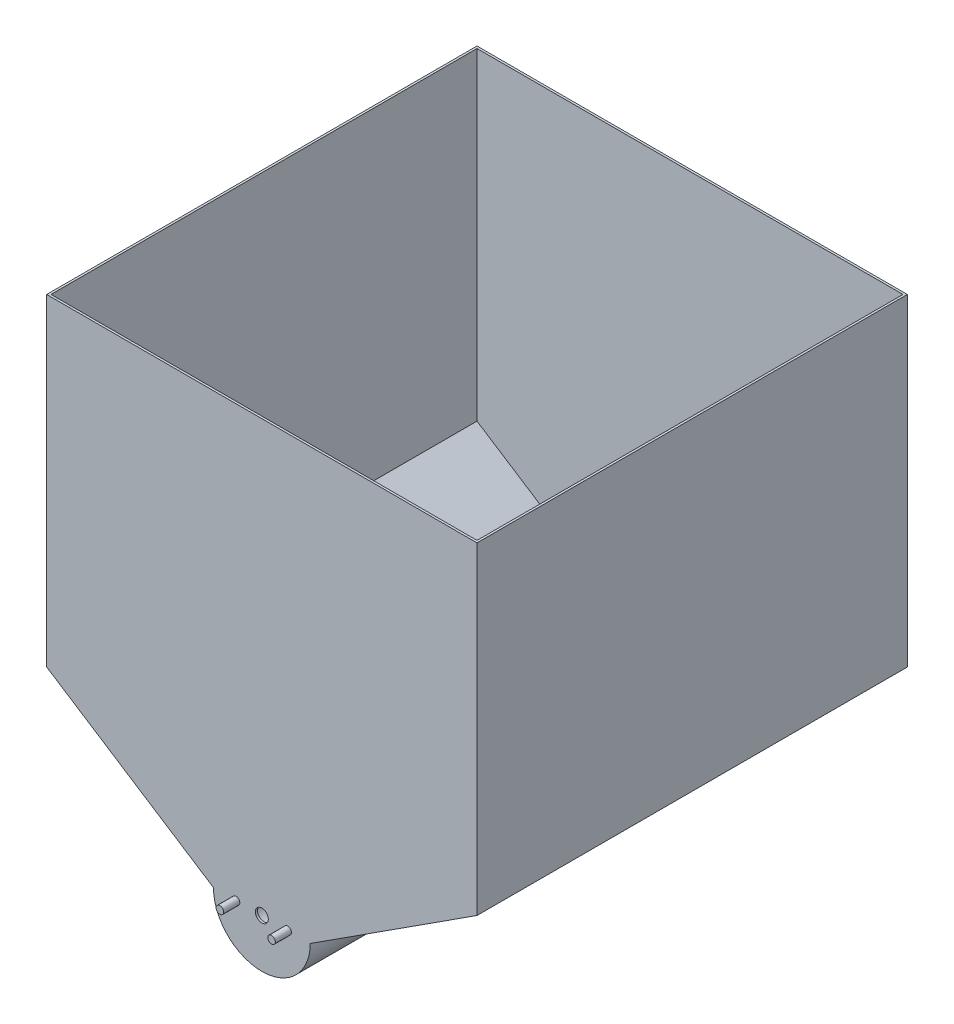
from build123d import *

# Parameters (mm, degrees)
SKETCH1_W               = 400
SKETCH1_H               = 400
SKETCH1_W_2             = 396
SKETCH1_H_2             = 396
BOSS_EXTRUDE1_DEPTH     = 300
CUT_LOFT1_START         = 2
CUT_LOFT1_DEPTH         = 396
BOSS_EXTRUDE2_DEPTH     = 400
BOSS_EXTRUDE3_DEPTH     = 2
BOSS_EXTRUDE6_START     = -398
BOSS_EXTRUDE6_DEPTH     = 2
CUT_EXTRUDE1_DEPTH      = 641.312423915
CUT_EXTRUDE1_DEPTH_BACK = 641.312423915
SKETCH9_R               = 6
BOSS_EXTRUDE4_START     = -2
SKETCH10_R              = 16
SKETCH10_R_2            = 14
BOSS_EXTRUDE4_DEPTH     = 16
BOSS_EXTRUDE5_START     = -18
SKETCH11_R              = 16
SKETCH11_R_2            = 14
BOSS_EXTRUDE5_DEPTH     = 16
CUT_EXTRUDE2_DEPTH      = 720.739536394
CUT_EXTRUDE2_DEPTH_BACK = 720.739536394
SKETCH13_R              = 30
SKETCH14_R              = 3.5
BOSS_EXTRUDE7_DEPTH     = 15
BOSS_EXTRUDE8_START     = -415
SKETCH14_2_R            = 3.5
BOSS_EXTRUDE8_DEPTH     = 15


# Read off the part's stored shape, not the designer's step: Cut-Loft1
with BuildPart() as part:
    # Sketch1 → Boss-Extrude1 (new body)
    with BuildSketch(Plane(origin=(0, 0, 0), x_dir=(1, 0, 0), z_dir=(0, 1, 0))):
        with Locations((200, -200)):
            Rectangle(SKETCH1_W, SKETCH1_H)
        with Locations((200, -200)):
            Rectangle(SKETCH1_W_2, SKETCH1_H_2, mode=Mode.SUBTRACT)
    extrude(amount=BOSS_EXTRUDE1_DEPTH)

    # Upper_profile → Loft6 section 0
    with BuildSketch(Plane(origin=(0, 0, 0), x_dir=(1, 0, 0), z_dir=(0, 1, 0))):
        with BuildLine():
            Line((0, 0), (400, 0))
            Line((400, 0), (400, -400))
            Line((400, -400), (0, -400))
            Line((0, -400), (0, 0))
        make_face()
    # Bellow_profile → Loft6 section 1
    with BuildSketch(Plane(origin=(0, -100, 0), x_dir=(1, 0, 0), z_dir=(0, 1, 0))):
        with BuildLine():
            Line((155, 0), (245, 0))
            Line((245, 0), (245, -400))
            Line((245, -400), (155, -400))
            Line((155, -400), (155, 0))
        make_face()
    loft()

    # Cut-Loft1 outline → Cut-Loft1 (cut)
    with BuildSketch(Plane.XY.offset(CUT_LOFT1_START)):
        Polygon((157, -100), (243, -100), (398, 0), (2, 0), align=None)
    extrude(amount=CUT_LOFT1_DEPTH, mode=Mode.SUBTRACT)

    # Sketch7 → Boss-Extrude2 (add)
    with BuildSketch(Plane.XY.offset(400)):
        with BuildLine():
            Line((155, -100), (157, -100))
            ThreePointArc((157, -100), (200, -143), (243, -100))
            Line((243, -100), (245, -100))
            ThreePointArc((245, -100), (200, -145), (155, -100))
        make_face()
    extrude(amount=-BOSS_EXTRUDE2_DEPTH)

    # Sketch8 → Boss-Extrude3 (add)
    with BuildSketch(Plane.XY.offset(400)):
        with BuildLine():
            Line((245, -100), (155, -100))
            ThreePointArc((155, -100), (200, -145), (245, -100))
        make_face()
    extrude(amount=-BOSS_EXTRUDE3_DEPTH)

    # Sketch8<2> → Boss-Extrude6 (add)
    with BuildSketch(Plane.XY.offset(400).offset(BOSS_EXTRUDE6_START)):
        with BuildLine():
            Line((245, -100), (155, -100))
            ThreePointArc((155, -100), (200, -145), (245, -100))
        make_face()
    extrude(amount=-BOSS_EXTRUDE6_DEPTH)

    # Sketch9 → Cut-Extrude1 (cut, two sides: drawn at the far end of the back side and taken through both)
    with BuildSketch(Plane.XY.offset(400).offset(-CUT_EXTRUDE1_DEPTH_BACK)):
        with Locations(Location((200, -100, 0), (0, 0, 180))):
            Circle(SKETCH9_R)
    extrude(amount=CUT_EXTRUDE1_DEPTH + CUT_EXTRUDE1_DEPTH_BACK, mode=Mode.SUBTRACT)

    # Sketch10 → Boss-Extrude4 (add)
    with BuildSketch(Plane.XY.offset(400).offset(BOSS_EXTRUDE4_START)):
        with Locations(Location((200, -100, 0), (0, 0, 180))):
            Circle(SKETCH10_R)
        with Locations(Location((200, -100, 0), (0, 0, 180))):
            Circle(SKETCH10_R_2, mode=Mode.SUBTRACT)
    extrude(amount=-BOSS_EXTRUDE4_DEPTH)

    # Sketch11 → Boss-Extrude5 (add)
    with BuildSketch(Plane(origin=(0, 0, 0), x_dir=(-1, 0, 0), z_dir=(0, 0, -1)).offset(BOSS_EXTRUDE5_START)):
        with Locations((-200, -100)):
            Circle(SKETCH11_R)
        with Locations((-200, -100)):
            Circle(SKETCH11_R_2, mode=Mode.SUBTRACT)
    extrude(amount=BOSS_EXTRUDE5_DEPTH)

    # Sketch13 → Cut-Extrude2 (cut, two sides: drawn at the far end of the back side and taken through both)
    with BuildSketch(Plane(origin=(0, 300, 0), x_dir=(1, 0, 0), z_dir=(0, 1, 0)).offset(-CUT_EXTRUDE2_DEPTH_BACK)):
        with Locations(Location((200, -52, 0), (0, 0, 270))):
            Circle(SKETCH13_R)
    extrude(amount=CUT_EXTRUDE2_DEPTH + CUT_EXTRUDE2_DEPTH_BACK, mode=Mode.SUBTRACT)

    # Sketch14 → Boss-Extrude7 (add)
    with BuildSketch(Plane.XY.offset(400)):
        with Locations(Location((224, -100, 0), (0, 0, 180))):
            Circle(SKETCH14_R)
        with Locations(Location((176, -100, 0), (0, 0, 180))):
            Circle(SKETCH14_R)
    extrude(amount=BOSS_EXTRUDE7_DEPTH)

    # Sketch14<2> → Boss-Extrude8 (add)
    with BuildSketch(Plane.XY.offset(400).offset(BOSS_EXTRUDE8_START)):
        with Locations(Location((224, -100, 0), (0, 0, 180))):
            Circle(SKETCH14_2_R)
        with Locations(Location((176, -100, 0), (0, 0, 180))):
            Circle(SKETCH14_2_R)
    extrude(amount=BOSS_EXTRUDE8_DEPTH)


solid = part.part
